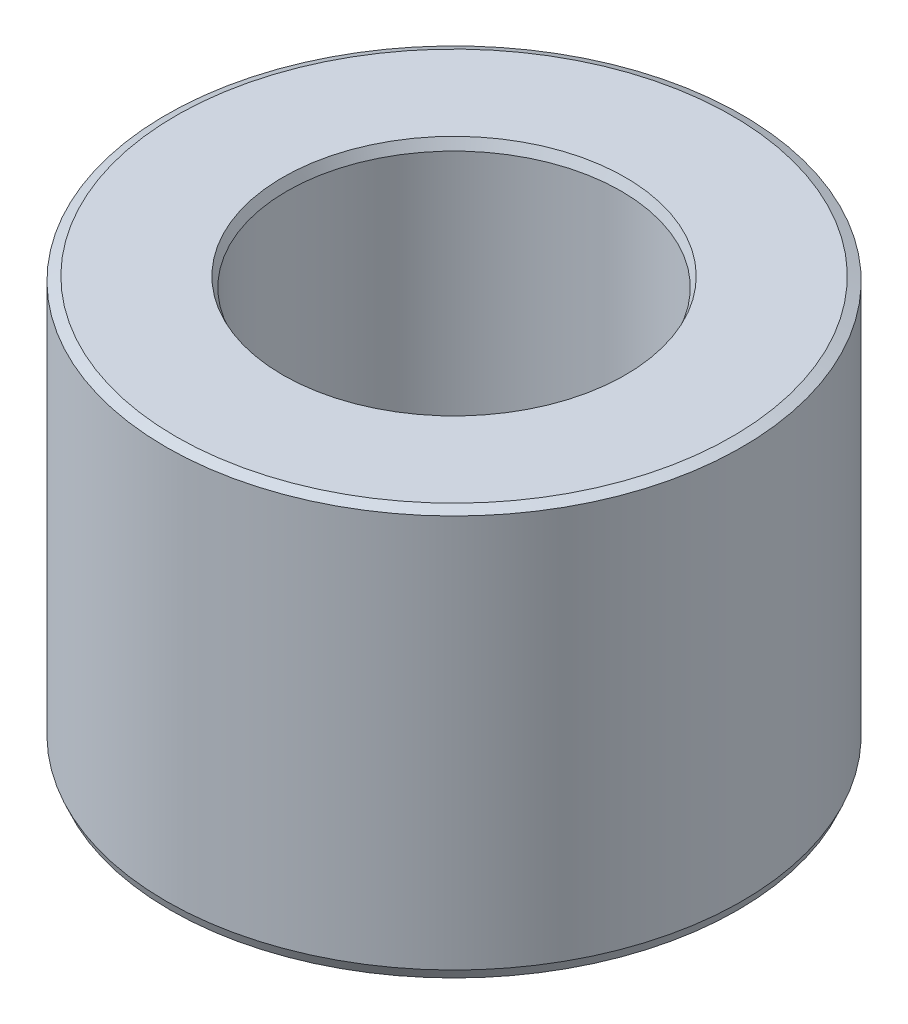
from build123d import *
from OCP.BRepFilletAPI import BRepFilletAPI_MakeChamfer

# Parameters (mm, degrees)
SKETCH1_R           = 35
BOSS_EXTRUDE1_DEPTH = 49.507959427
SKETCH2_R           = 20.312659311
CUT_EXTRUDE1_DEPTH  = 71.007414226
CHAMFER1_SIZE       = 0.50840749
CHAMFER1_SIZE2      = 1.194502987


with BuildPart() as part:
    # Sketch1 → Boss-Extrude1 (new body)
    with BuildSketch(Plane(origin=(0, 0, 0), x_dir=(1, 0, 0), z_dir=(0, 1, 0))):
        Circle(SKETCH1_R)
    extrude(amount=BOSS_EXTRUDE1_DEPTH)

    # Sketch2 → Cut-Extrude1 (cut, through all)
    with BuildSketch(Plane(origin=(0, 0, 0), x_dir=(1, 0, 0), z_dir=(0, 1, 0))):
        Circle(SKETCH2_R)
    extrude(amount=CUT_EXTRUDE1_DEPTH, mode=Mode.SUBTRACT)

    # Chamfer1: one chamfer whose edges measure the first distance from different faces: ONE call of the kernel's chamfer builder (chamfer() names one face for all edges)
    chamfer1_edges_1 = [part.edges().sort_by_distance(p)[0] for p in [
        (-20.312659311, 49.507959427, 0),
    ]]
    chamfer1_side_1 = [part.faces().sort_by_distance(p)[0] for p in [
        (-34.010050506, 49.507959427, 0),
    ]]
    chamfer1_edges_2 = [part.edges().sort_by_distance(p)[0] for p in [
        (-20.312659311, 0, 0),
    ]]
    chamfer1_side_2 = [part.faces().sort_by_distance(p)[0] for p in [
        (-20.312659311, 24.753979714, 0),
    ]]
    chamfer1_edges_3 = [part.edges().sort_by_distance(p)[0] for p in [
        (-35, 0, 0),
    ]]
    chamfer1_side_3 = [part.faces().sort_by_distance(p)[0] for p in [
        (-34.010050506, 0, 0),
    ]]
    chamfer1_edges_4 = [part.edges().sort_by_distance(p)[0] for p in [
        (-35, 49.507959427, 0),
    ]]
    chamfer1_side_4 = [part.faces().sort_by_distance(p)[0] for p in [
        (-35, 24.753979714, 0),
    ]]
    chamfer1 = BRepFilletAPI_MakeChamfer(part.part.solid().wrapped)
    for e in chamfer1_edges_1:
        chamfer1.Add(CHAMFER1_SIZE, CHAMFER1_SIZE2, e.wrapped, chamfer1_side_1[0].wrapped)  # the first distance lies on this face
    for e in chamfer1_edges_2:
        chamfer1.Add(CHAMFER1_SIZE, CHAMFER1_SIZE2, e.wrapped, chamfer1_side_2[0].wrapped)  # the first distance lies on this face
    for e in chamfer1_edges_3:
        chamfer1.Add(CHAMFER1_SIZE, CHAMFER1_SIZE2, e.wrapped, chamfer1_side_3[0].wrapped)  # the first distance lies on this face
    for e in chamfer1_edges_4:
        chamfer1.Add(CHAMFER1_SIZE, CHAMFER1_SIZE2, e.wrapped, chamfer1_side_4[0].wrapped)  # the first distance lies on this face
    add(Compound.cast(chamfer1.Shape()), mode=Mode.REPLACE)


solid = part.part
